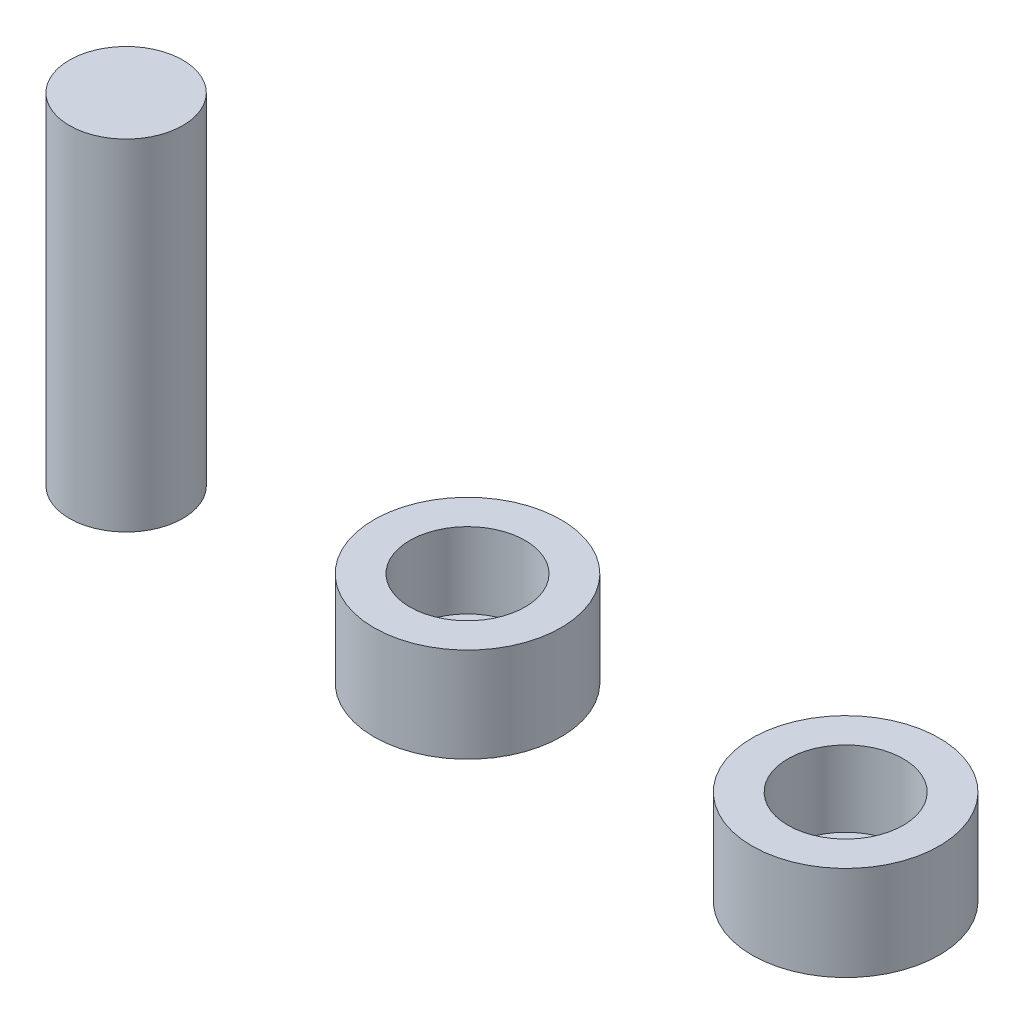
from build123d import *

# Parameters (mm, degrees)
SKETCH1_R           = 2.475
BOSS_EXTRUDE1_DEPTH = 2.5
SKETCH2_R           = 1.5
BOSS_EXTRUDE2_DEPTH = 9
SKETCH4_R           = 1.525
CUT_EXTRUDE1_DEPTH  = 2


with BuildPart() as part:
    # Sketch1 → Boss-Extrude1 (new body)
    with BuildSketch(Plane(origin=(0, 0, 0), x_dir=(1, 0, 0), z_dir=(0, 1, 0))):
        Circle(SKETCH1_R)
    extrude(amount=BOSS_EXTRUDE1_DEPTH)

    # Sketch4 → Cut-Extrude1 (cut)
    with BuildSketch(Plane(origin=(0, 2.5, 0), x_dir=(1, 0, 0), z_dir=(0, 1, 0))):
        Circle(SKETCH4_R)
    extrude(amount=-CUT_EXTRUDE1_DEPTH, mode=Mode.SUBTRACT)


with BuildPart() as body_2:
    # Sketch2 → Boss-Extrude2 (new body)
    with BuildSketch(Plane(origin=(0, 0, 0), x_dir=(1, 0, 0), z_dir=(0, 1, 0))):
        with Locations((-9.027296586, 0)):
            Circle(SKETCH2_R)
    extrude(amount=BOSS_EXTRUDE2_DEPTH)


with BuildPart() as body_3:
    # Mirror1: mirrored copy
    add(part.part.mirror(Plane(origin=(5, 0, 0), x_dir=(0, 0, 1), z_dir=(1, 0, 0))))


solid = Compound([part.part, body_2.part, body_3.part])
